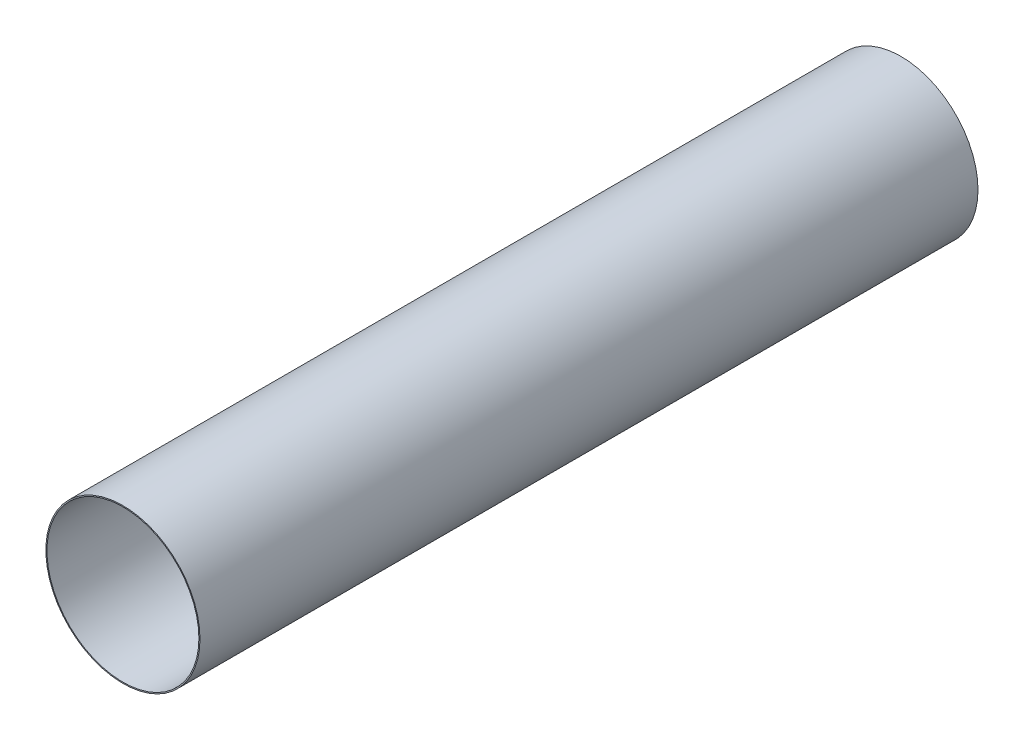
from build123d import *

# Parameters (mm, degrees)
SKETCH1_R           = 80.518
SKETCH1_R_2         = 79.375
BOSS_EXTRUDE1_DEPTH = 812.8


with BuildPart() as part:
    # Sketch1 → Boss-Extrude1 (new body)
    with BuildSketch(Plane.XY):
        Circle(SKETCH1_R)
        Circle(SKETCH1_R_2, mode=Mode.SUBTRACT)
    extrude(amount=BOSS_EXTRUDE1_DEPTH)


solid = part.part
